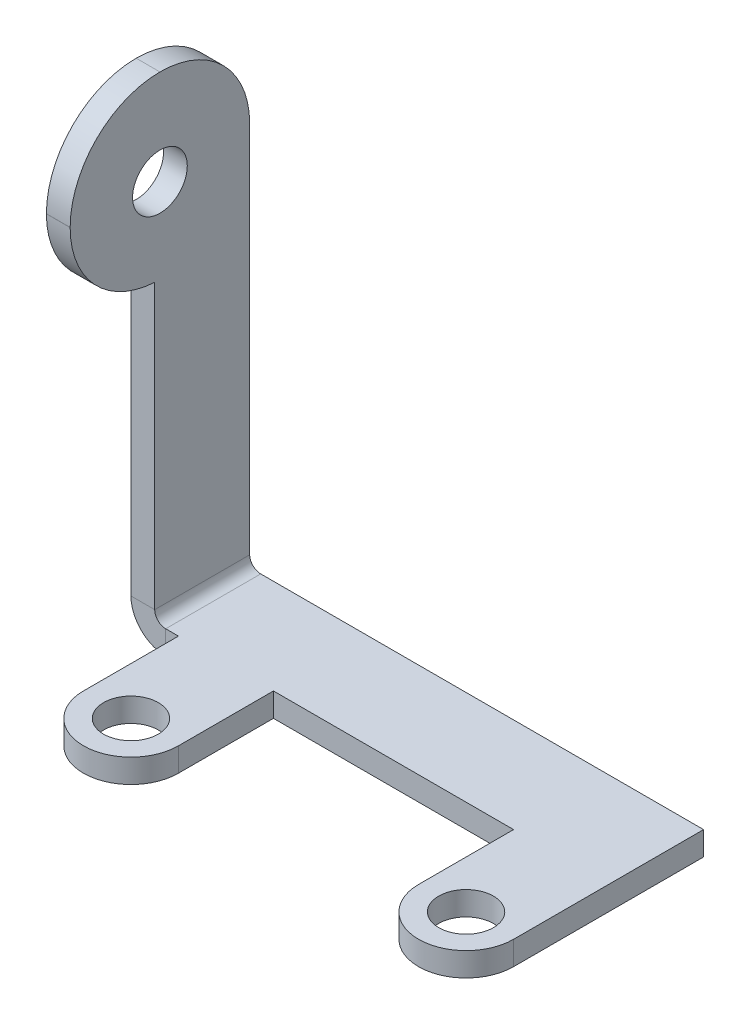
from build123d import *

# Parameters (mm, degrees)
SKETCH1_R                    = 1.8288
BASE_FLANGE1_DEPTH           = 1.5875
EDGE_FLANGE2_STRIP_W         = 7.8232
EDGE_FLANGE2_STRIP_H         = 1.5875
EDGE_FLANGE2_STRIP_CUT_DEPTH = 6.35
EDGE_FLANGE2_DEPTH           = 6.35
SKETCH19_W                   = 5.65
SKETCH19_H                   = 12
TAB1_DEPTH                   = 1.5875
HOLE1_START                  = -28.75
HOLE1_OUTLINE_R              = 1.8288
HOLE1_DEPTH                  = 1.5875
FILLET1_R                    = 6


# Read off the part's stored shape, not the designer's step: Hole1
# Sheet-metal steps are written as plain solids
with BuildPart() as part:
    # Sketch1 → Base-Flange1 (new body)
    with BuildSketch(Plane(origin=(0, 0, 0), x_dir=(1, 0, 0), z_dir=(0, 1, 0))):
        with BuildLine():
            Line((-25.575, 0), (-25.575, 6.35))
            Line((-25.575, 6.35), (-27.1625, 6.35))
            Line((-27.1625, 6.35), (-27.1625, 12.7))
            Line((-27.1625, 12.7), (3.175, 12.7))
            Line((3.175, 12.7), (3.175, 6.35))
            Line((3.175, 6.35), (3.175, 0))
            ThreePointArc((3.175, 0), (0, -3.175), (-3.175, 0))
            Line((-3.175, 0), (-3.175, 6.35))
            Line((-3.175, 6.35), (-19.225, 6.35))
            Line((-19.225, 6.35), (-19.225, 0))
            ThreePointArc((-19.225, 0), (-22.4, -3.175), (-25.575, 0))
        make_face()
        with Locations(Location((0, 0, 0), (0, 0, 270))):
            Circle(SKETCH1_R, mode=Mode.SUBTRACT)
        with Locations(Location((-22.4, 0, 0), (0, 0, 270))):
            Circle(SKETCH1_R, mode=Mode.SUBTRACT)
    extrude(amount=BASE_FLANGE1_DEPTH)

    # Edge-Flange2 strip (across the edge) → Edge-Flange2 strip cut (cut)
    with BuildSketch(Plane(origin=(-27.1625, 1.5875, -12.7), x_dir=(1, 0, 0), z_dir=(0, 0, 1))):
        with Locations((-3.175, -0.79375)):
            Rectangle(EDGE_FLANGE2_STRIP_W, EDGE_FLANGE2_STRIP_H)
    extrude(amount=EDGE_FLANGE2_STRIP_CUT_DEPTH, mode=Mode.SUBTRACT)

    # Edge-Flange2 section (across the edge) → Edge-Flange2 (add)
    with BuildSketch(Plane(origin=(-27.1625, 1.5875, -12.7), x_dir=(1, 0, 0), z_dir=(0, 0, 1))):
        with BuildLine():
            Line((-1.5875, 0.7366), (-1.5875, 31.688))
            Line((-1.5875, 31.688), (0, 31.688))
            Line((0, 31.688), (0, 0.7366))
            ThreePointArc((0, 0.7366), (0.215745145, 0.215745145), (0.7366, 0))
            Line((0.7366, 0), (0.7366, -1.5875))
            ThreePointArc((0.7366, -1.5875), (-0.90678687, -0.90678687), (-1.5875, 0.7366))
        make_face()
    extrude(amount=EDGE_FLANGE2_DEPTH)

    # Sketch19 → Tab1 (add)
    with BuildSketch(Plane.ZY.offset(28.75)):
        with Locations((-3.525, 27.2755)):
            Rectangle(SKETCH19_W, SKETCH19_H)
    extrude(amount=-TAB1_DEPTH)

    # Hole1 outline → Hole1 (cut)
    with BuildSketch(Plane.YZ.offset(HOLE1_START)):
        with Locations((26.9255, -6.7)):
            Circle(HOLE1_OUTLINE_R)
    extrude(amount=HOLE1_DEPTH, mode=Mode.SUBTRACT)

    # Fillet1
    # the kernel refuses this fillet: 6 mm, written as the material it takes off along each edge
    with BuildSketch(Plane(origin=(-43.724457419, 21.2755, -0.7), x_dir=(0, 0, -1), z_dir=(1, 0, 0))) as fillet1_piece_1:
        with BuildLine():
            CenterArc((6, 5.989782968), FILLET1_R, 180, 86.655847796)
            Line((0, 5.989782968), (-0.12, 5.989782968))
            Line((-0.12, 5.989782968), (-0.12, 0))
            Line((-0.12, 0), (0, -0.12))
            ThreePointArc((0, -0.12), (2.825, -0.12), (5.643, -0.119795659))
            Line((5.643, -0.119795659), (5.65, 0))
        make_face()
    extrude(amount=31.536414838, mode=Mode.SUBTRACT)
    with BuildSketch(Plane(origin=(-43.75, 33.2755, -0.7), x_dir=(0, 0, -1), z_dir=(1, 0, 0)), Plane(origin=(-43.75, 33.2755, -12.7), x_dir=(0, -1, 0), z_dir=(1, 0, 0))) as fillet1_piece_2:
        with BuildLine():
            CenterArc((FILLET1_R, -FILLET1_R), FILLET1_R, 90, 90)
            Line((0, -FILLET1_R), (-FILLET1_R * 0.02, -FILLET1_R))
            Line((-FILLET1_R * 0.02, -FILLET1_R), (-FILLET1_R * 0.02, FILLET1_R * 0.02))
            Line((-FILLET1_R * 0.02, FILLET1_R * 0.02), (FILLET1_R, FILLET1_R * 0.02))
            Line((FILLET1_R, FILLET1_R * 0.02), (FILLET1_R, 0))
        make_face()
    extrude(amount=31.5875, mode=Mode.SUBTRACT)


solid = part.part
